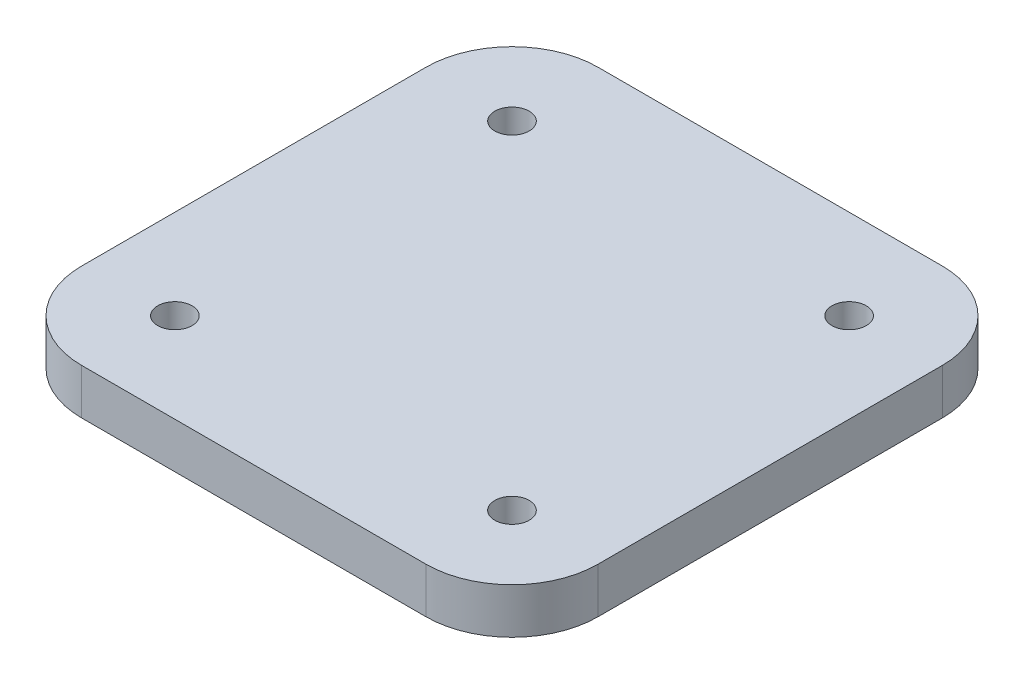
from build123d import *

# Parameters (mm, degrees)
BOSS_EXTRUDE1_DEPTH = 6.35
SKETCH2_R           = 2.4
CUT_EXTRUDE1_DEPTH  = 52.306164347


with BuildPart() as part:
    # Sketch1 → Boss-Extrude1 (new body)
    with BuildSketch(Plane(origin=(0, 0, 0), x_dir=(1, 0, 0), z_dir=(0, 1, 0))):
        with BuildLine():
            Line((-24, -36), (24, -36))
            ThreePointArc((24, -36), (32.485281374, -32.485281374), (36, -24))
            Line((36, -24), (36, 24))
            ThreePointArc((36, 24), (32.485281374, 32.485281374), (24, 36))
            Line((24, 36), (-24, 36))
            ThreePointArc((-24, 36), (-32.485281374, 32.485281374), (-36, 24))
            Line((-36, 24), (-36, -24))
            ThreePointArc((-36, -24), (-32.485281374, -32.485281374), (-24, -36))
        make_face()
    extrude(amount=BOSS_EXTRUDE1_DEPTH)

    # Sketch2 → Cut-Extrude1 (cut, through all)
    with BuildSketch(Plane(origin=(0, 6.35, 0), x_dir=(1, 0, 0), z_dir=(0, 1, 0))):
        with Locations((-23.5, 23.5)):
            Circle(SKETCH2_R)
        with Locations((23.5, 23.5)):
            Circle(SKETCH2_R)
        with Locations((23.5, -23.5)):
            Circle(SKETCH2_R)
        with Locations((-23.5, -23.5)):
            Circle(SKETCH2_R)
    extrude(amount=-CUT_EXTRUDE1_DEPTH, mode=Mode.SUBTRACT)


solid = part.part
